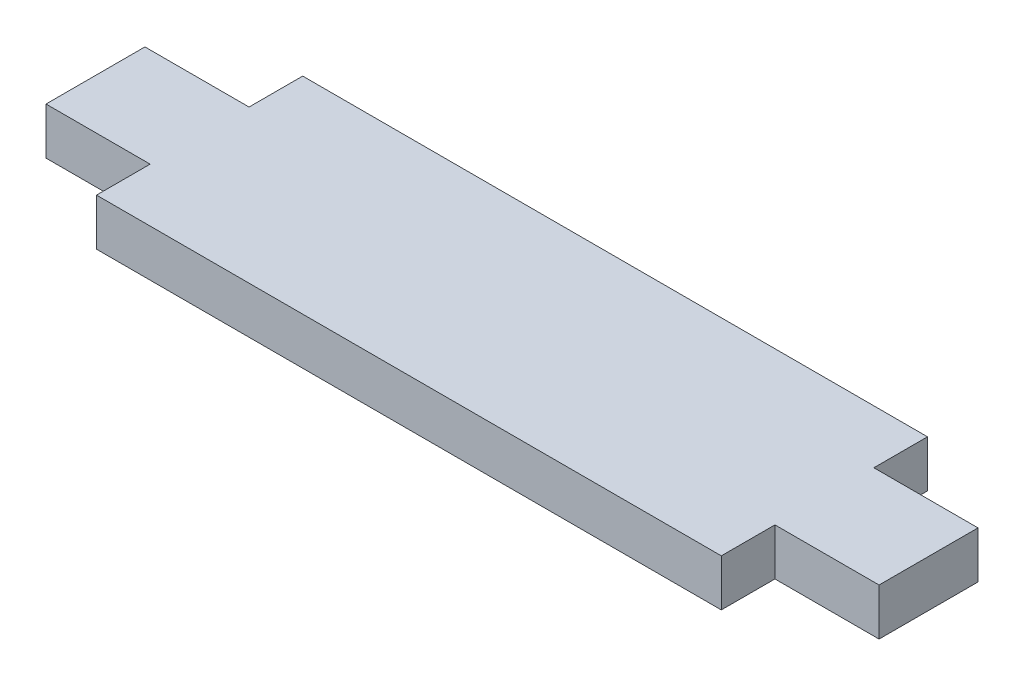
from build123d import *

# Parameters (mm, degrees)
SKETCH1_W           = 19.8
SKETCH1_H           = 4.5
BOSS_EXTRUDE1_DEPTH = 30
SKETCH2_W           = 9.5
SKETCH2_H           = 4.5
BOSS_EXTRUDE2_DEPTH = 10


with BuildPart() as part:
    # Sketch1 → Boss-Extrude1 (new, symmetric)
    with BuildSketch(Plane(origin=(0, 0, 0), x_dir=(0, 0, -1), z_dir=(1, 0, 0))):
        Rectangle(SKETCH1_W, SKETCH1_H)
    extrude(amount=BOSS_EXTRUDE1_DEPTH, both=True)

    # Sketch2 → Boss-Extrude2 (add)
    with BuildSketch(Plane(origin=(30, 0, 0), x_dir=(0, 0, -1), z_dir=(1, 0, 0))):
        Rectangle(SKETCH2_W, SKETCH2_H)
    boss_extrude2 = extrude(amount=BOSS_EXTRUDE2_DEPTH)

    # Mirror1: Boss-Extrude2 across plane
    add(boss_extrude2.mirror(Plane(origin=(0, 0, 0), x_dir=(0, 0, 1), z_dir=(1, 0, 0))))


solid = part.part
